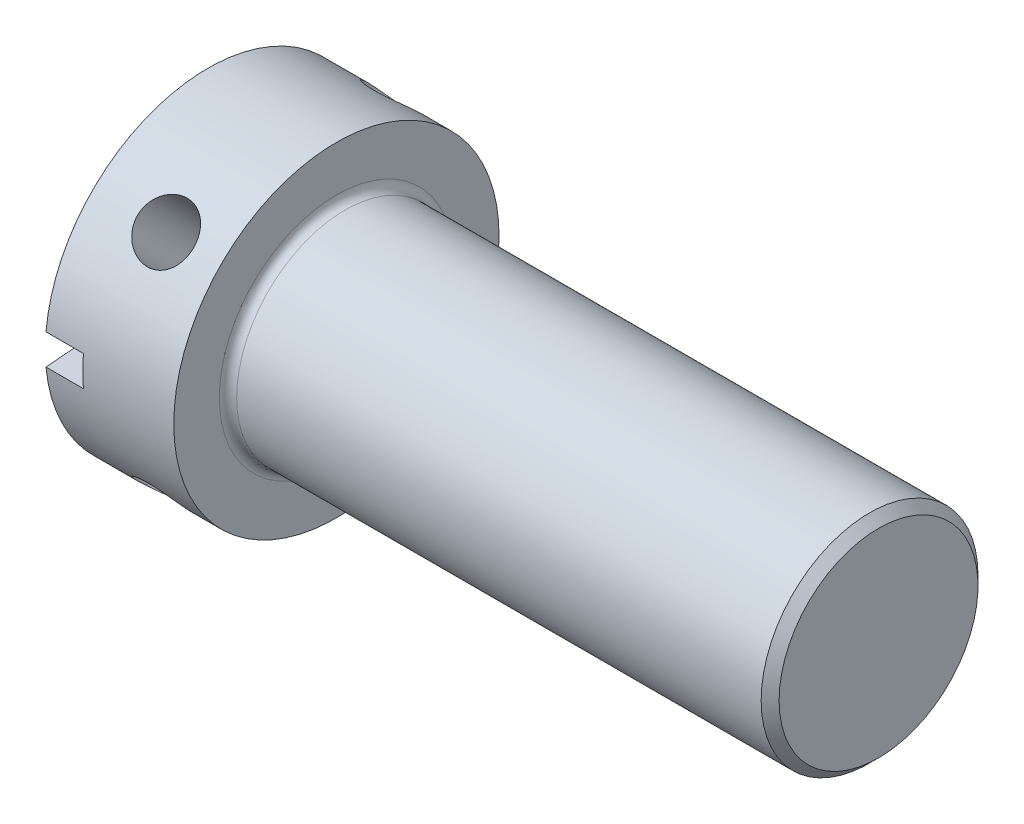
from build123d import *

# Parameters (mm, degrees)
FILLET1_R         = 0.8
SLOT_DEPTH        = 67.001893912
SLOT_DEPTH_BACK   = 67.001893912
HOLESKE_R         = 2.59
DRILL_HOLE_DEPTH  = 67.001893912
DRILL_HOLES_COUNT = 2
DRILL_HOLES_ANGLE = 90


with BuildPart() as part:
    # BodySke → Base-Revolve (revolve)
    with BuildSketch(Plane.XY):
        with BuildLine():
            Line((0.65, 15), (12.5, 15))
            Line((12.5, 15), (12.5, 10))
            Line((12.5, 10), (61.672, 10))
            Line((61.672, 10), (62.5, 9.172))
            Line((62.5, 9.172), (62.5, 0))
            Line((62.5, 0), (0, 0))
            ThreePointArc((0, 0), (0.162576213, 7.507038364), (0.65, 15))
        make_face()
    revolve(axis=Axis((-31.75, 0, 0), (1, 0, 0)))

    # Fillet1
    fillet1_edges = [part.edges().sort_by_distance(p)[0] for p in [
        (12.5, -10, 0),
    ]]
    fillet(fillet1_edges, radius=FILLET1_R)

    # Sketch3 → Slot (cut, two sides: drawn at the far end of the back side and taken through both)
    with BuildSketch(Plane.XY.offset(-SLOT_DEPTH_BACK)):
        Polygon((-139.217564887, 1.405), (0.005692144, 1.405), (4.105692144, 1.405), (4.105692144, -1.405), (0.005692144, -1.405), (-139.217564887, -1.405), (-417.664078948, -1.405), (-417.664078948, 1.405), align=None)
    extrude(amount=SLOT_DEPTH + SLOT_DEPTH_BACK, mode=Mode.SUBTRACT)

    # HoleSke → Drill Hole (cut, symmetric)
    with BuildSketch(Plane(origin=(0, 0, 0), x_dir=(1, 0, 0), z_dir=(0, 0.7071067811865462, 0.7071067811865488))):
        with Locations((7.35, 0)):
            Circle(HOLESKE_R)
    drill_hole = extrude(amount=DRILL_HOLE_DEPTH, both=True, mode=Mode.SUBTRACT)

    # Drill Holes: Drill Hole ×2 about axis
    drill_holes_axis = Axis((0, 0, 0), (1, 0, 0))
    for i in range(1, DRILL_HOLES_COUNT):
        add(drill_hole.rotate(drill_holes_axis, i * DRILL_HOLES_ANGLE / (DRILL_HOLES_COUNT - 1)), mode=Mode.SUBTRACT)


solid = part.part
